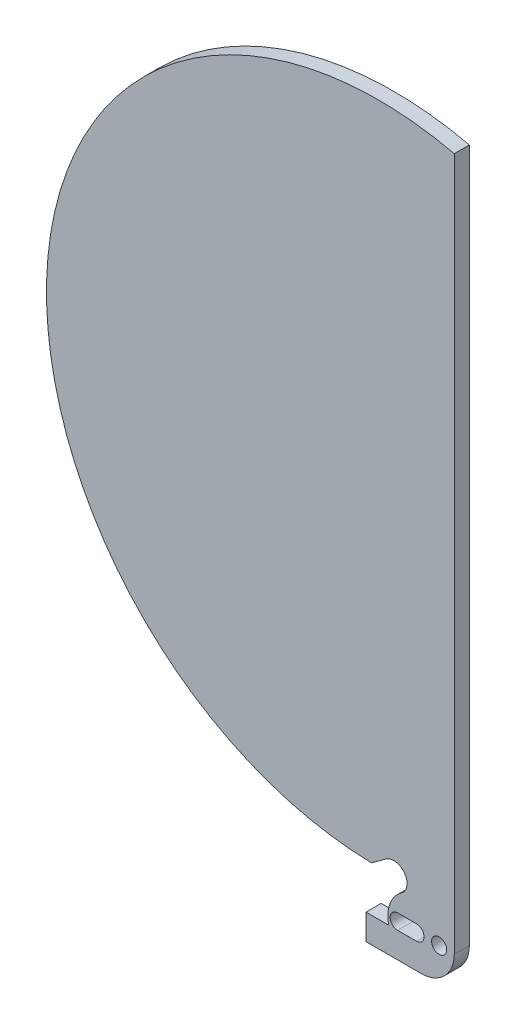
from build123d import *

# Parameters (mm, degrees)
SKETCH2_R           = 0.5
BOSS_EXTRUDE1_DEPTH = 0.5


with BuildPart() as part:
    # Sketch2 → Boss-Extrude1 (new, symmetric)
    with BuildSketch(Plane.XY):
        with BuildLine():
            Line((0, -2.5), (0, 43.417676611))
            ThreePointArc((0, 43.417676611), (-26.830952435, 24.756368266), (-5.493973549, 0))
            Line((-5.493973549, 0), (-4.517025893, 0.706045249))
            ThreePointArc((-4.517025893, 0.706045249), (-3.291355629, 0.508755632), (-3.488645246, -0.716914632))
            ThreePointArc((-3.488645246, -0.716914632), (-4.260627698, -1.729407054), (-4.342428529, -3))
            Line((-4.342428529, -3), (-5.842428529, -3))
            Line((-5.842428529, -3), (-5.842428529, -4.7))
            Line((-5.842428529, -4.7), (-2.2, -4.7))
            ThreePointArc((-2.2, -4.7), (-0.644365081, -4.055634919), (0, -2.5))
        make_face()
        with Locations((-1, -2.5)):
            Circle(SKETCH2_R, mode=Mode.SUBTRACT)
        with BuildLine():
            Line((-3.75, -2), (-2.499999877, -2))
            ThreePointArc((-2.499999877, -2), (-2, -2.500000061), (-2.5, -3))
            Line((-2.5, -3), (-3.75, -3))
            ThreePointArc((-3.75, -3), (-4.25, -2.5), (-3.75, -2))
        make_face(mode=Mode.SUBTRACT)
    extrude(amount=BOSS_EXTRUDE1_DEPTH, both=True)


solid = part.part
